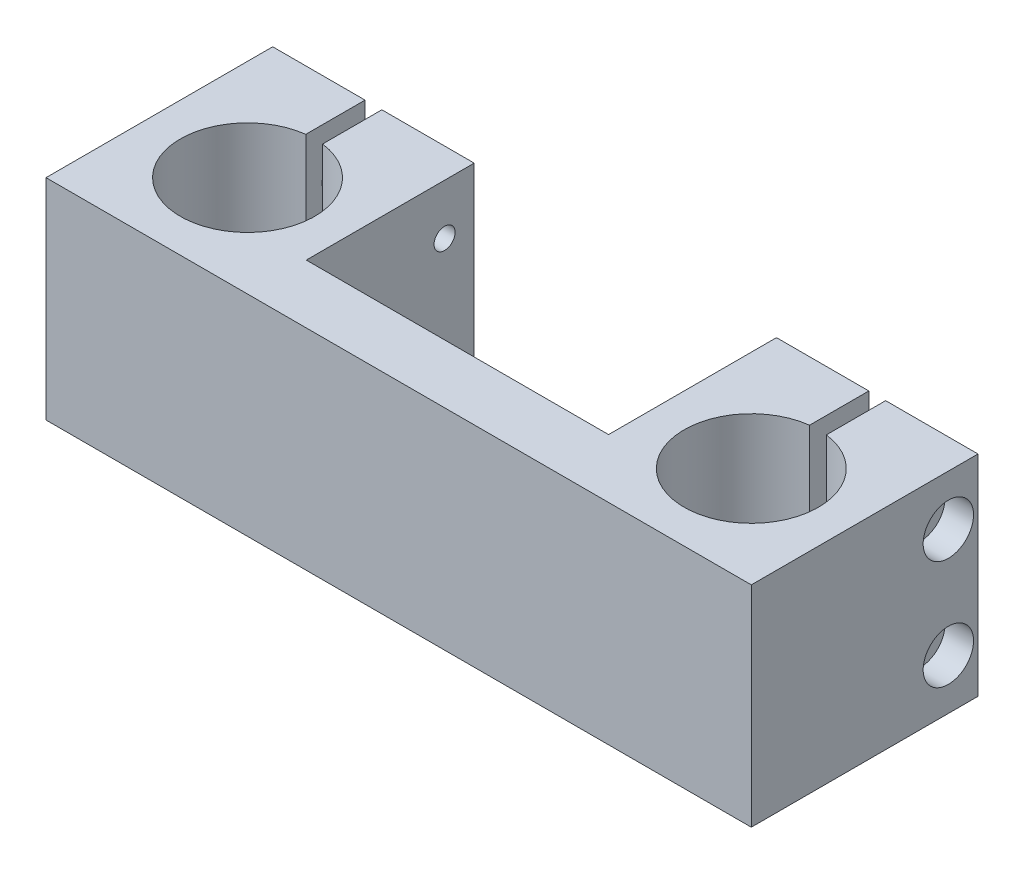
from build123d import *

# Parameters (mm, degrees)
SKETCH_1_R                = 8
EXTRUDE_1_DEPTH           = 25
SKETCH_2_W                = 2
SKETCH_2_H                = 7.062746067
CUT_EXTRUDE_1_DEPTH       = 56.839054433
HOLE_START                = -42
HOLE_WIZARD_1_OUTLINE_R   = 3
HOLE_WIZARD_1_DEPTH       = 3.4
HOLE_START_2              = -38.6
HOLE_WIZARD_1_2_OUTLINE_R = 1.6
HOLE_WIZARD_1_2_DEPTH     = 7.6
HOLE_WIZARD_M3_1_D        = 2.5
HOLE_WIZARD_M3_1_DEPTH    = 11.001


# Read off the part's stored shape, not the designer's step: 打孔尺寸(%根据)内六角圆柱头螺钉的类型1
with BuildPart() as part:
    # 草图1 → 凸台-拉伸1 (new body)
    with BuildSketch(Plane(origin=(0, 0, 0), x_dir=(1, 0, 0), z_dir=(0, 1, 0))):
        Polygon((-18, 27), (-18, 7), (18, 7), (18, 27), (42, 27), (42, 0), (-42, 0), (-42, 27), align=None)
        with Locations(Location((-30, 12, 0), (0, 0, 270))):
            Circle(SKETCH_1_R, mode=Mode.SUBTRACT)
        with Locations(Location((30, 12, 0), (0, 0, 90))):
            Circle(SKETCH_1_R, mode=Mode.SUBTRACT)
    extrude(amount=EXTRUDE_1_DEPTH)

    # 草图2 → 切除-拉伸1 (cut, through all)
    with BuildSketch(Plane(origin=(0, 25, 0), x_dir=(1, 0, 0), z_dir=(0, 1, 0))):
        with Locations((-30, 23.468626967)):
            Rectangle(SKETCH_2_W, SKETCH_2_H)
    cut_extrude_1 = extrude(amount=-CUT_EXTRUDE_1_DEPTH, mode=Mode.SUBTRACT)

    # 打孔尺寸(%根据)内六角圆柱头螺钉的类型1 outline → 打孔尺寸(%根据)内六角圆柱头螺钉的类型1 (cut)
    with BuildSketch(Plane.YZ.offset(HOLE_START)):
        with Locations((6, -23.468626967)):
            Circle(HOLE_WIZARD_1_OUTLINE_R)
        with Locations((19, -23.468626967)):
            Circle(HOLE_WIZARD_1_OUTLINE_R)
    hole_wizard_1 = extrude(amount=HOLE_WIZARD_1_DEPTH, mode=Mode.SUBTRACT)

    # Hole Wizard 1 2 outline → Hole Wizard 1 2 (cut)
    with BuildSketch(Plane.YZ.offset(HOLE_START_2)):
        with Locations((6, -23.468626967)):
            Circle(HOLE_WIZARD_1_2_OUTLINE_R)
        with Locations((19, -23.468626967)):
            Circle(HOLE_WIZARD_1_2_OUTLINE_R)
    hole_wizard_1_2 = extrude(amount=HOLE_WIZARD_1_2_DEPTH, mode=Mode.SUBTRACT)

    # M3 螺纹孔1
    with Locations(Plane(origin=(-18, 0, 0), x_dir=(0, 0, -1), z_dir=(1, 0, 0))):
        with Locations((23.468626967, 19), (23.468626967, 6)):
            hole_wizard_m3_1 = Hole(HOLE_WIZARD_M3_1_D / 2, depth=HOLE_WIZARD_M3_1_DEPTH)

    # 镜向1: 切除-拉伸1, 打孔尺寸(%根据)内六角圆柱头螺钉的类型1, Hole Wizard 1 2, M3 螺纹孔1 across plane
    add(cut_extrude_1.mirror(Plane(origin=(0, 0, 0), x_dir=(0, 0, 1), z_dir=(1, 0, 0))), mode=Mode.SUBTRACT)
    add(hole_wizard_1.mirror(Plane(origin=(0, 0, 0), x_dir=(0, 0, 1), z_dir=(1, 0, 0))), mode=Mode.SUBTRACT)
    add(hole_wizard_1_2.mirror(Plane(origin=(0, 0, 0), x_dir=(0, 0, 1), z_dir=(1, 0, 0))), mode=Mode.SUBTRACT)
    add(hole_wizard_m3_1.mirror(Plane(origin=(0, 0, 0), x_dir=(0, 0, 1), z_dir=(1, 0, 0))), mode=Mode.SUBTRACT)


solid = part.part
